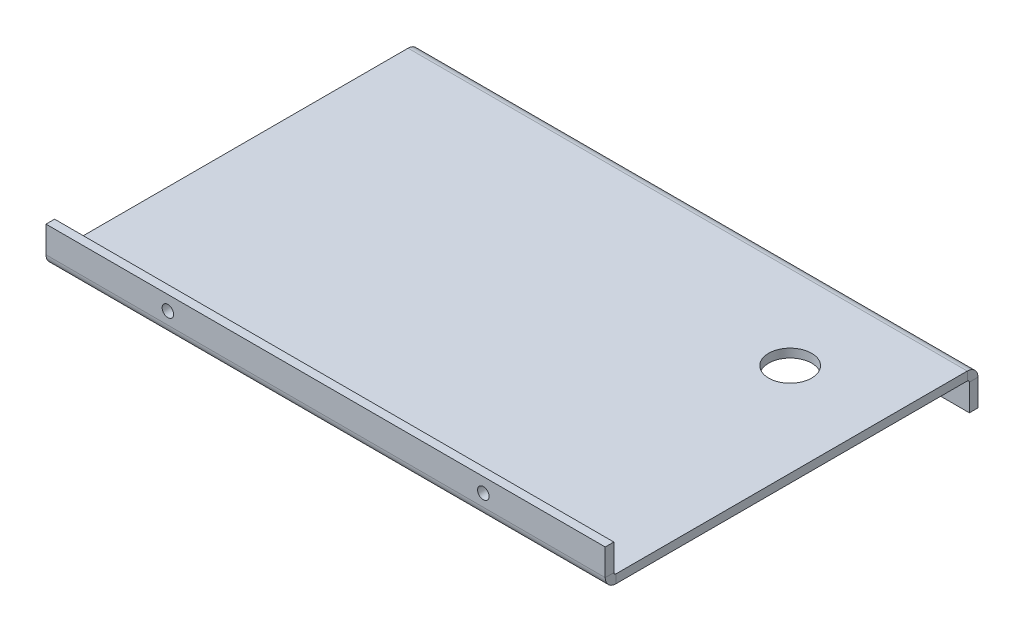
from build123d import *

# Parameters (mm, degrees)
SKETCH_1_W                       = 195
SKETCH_1_H                       = 130
SM_BASE_FLANGE_1_DEPTH           = 3
SM_EDGE_FLANGE_1_STRIP_W         = 13.4732
SM_EDGE_FLANGE_1_STRIP_H         = 3
SM_EDGE_FLANGE_1_STRIP_CUT_DEPTH = 195
SM_EDGE_FLANGE_1_DEPTH           = 195
SM_EDGE_FLANGE_2_STRIP_W         = 13.4732
SM_EDGE_FLANGE_2_STRIP_H         = 3
SM_EDGE_FLANGE_2_STRIP_CUT_DEPTH = 195
SM_EDGE_FLANGE_2_DEPTH           = 195
SKETCH_12_R                      = 2
CUT_EXTRUDE_1_DEPTH              = 10
SKETCH_13_R                      = 2
CUT_EXTRUDE_2_DEPTH              = 10
CUT_EXTRUDE_3_REACH              = 119.899
SKETCH_14_R                      = 7.5


# Sheet-metal steps are written as plain solids
with BuildPart() as part:
    # Sketch 1 → 基体-法兰1 (new body)
    with BuildSketch(Plane(origin=(0, 0, 0), x_dir=(1, 0, 0), z_dir=(0, 1, 0))):
        Rectangle(SKETCH_1_W, SKETCH_1_H)
    extrude(amount=-SM_BASE_FLANGE_1_DEPTH)

    # 边线-法兰1 strip (across the edge) → 边线-法兰1 strip cut (cut)
    with BuildSketch(Plane(origin=(-97.5, 0, 65), x_dir=(0, 0, -1), z_dir=(1, 0, 0))):
        with Locations((-3, -1.5)):
            Rectangle(SM_EDGE_FLANGE_1_STRIP_W, SM_EDGE_FLANGE_1_STRIP_H)
    extrude(amount=SM_EDGE_FLANGE_1_STRIP_CUT_DEPTH, mode=Mode.SUBTRACT)

    # 边线-法兰1 section (across the edge) → 边线-法兰1 (add)
    with BuildSketch(Plane(origin=(-97.5, 0, 65), x_dir=(0, 0, -1), z_dir=(1, 0, 0))):
        with BuildLine():
            Line((0, 0.7366), (0, 10))
            Line((0, 10), (3, 10))
            Line((3, 10), (3, 0.7366))
            ThreePointArc((3, 0.7366), (3.215745145, 0.215745145), (3.7366, 0))
            Line((3.7366, 0), (3.7366, -3))
            ThreePointArc((3.7366, -3), (1.094424801, -1.905575199), (0, 0.7366))
        make_face()
    extrude(amount=SM_EDGE_FLANGE_1_DEPTH)

    # 边线-法兰2 strip (across the edge) → 边线-法兰2 strip cut (cut)
    with BuildSketch(Plane(origin=(-97.5, -3, -65), x_dir=(0, 0, 1), z_dir=(1, 0, 0))):
        with Locations((-3, -1.5)):
            Rectangle(SM_EDGE_FLANGE_2_STRIP_W, SM_EDGE_FLANGE_2_STRIP_H)
    extrude(amount=SM_EDGE_FLANGE_2_STRIP_CUT_DEPTH, mode=Mode.SUBTRACT)

    # 边线-法兰2 section (across the edge) → 边线-法兰2 (add)
    with BuildSketch(Plane(origin=(-97.5, -3, -65), x_dir=(0, 0, 1), z_dir=(1, 0, 0))):
        with BuildLine():
            Line((0, 0.7366), (0, 10))
            Line((0, 10), (3, 10))
            Line((3, 10), (3, 0.7366))
            ThreePointArc((3, 0.7366), (3.215745145, 0.215745145), (3.7366, 0))
            Line((3.7366, 0), (3.7366, -3))
            ThreePointArc((3.7366, -3), (1.094424801, -1.905575199), (0, 0.7366))
        make_face()
    extrude(amount=SM_EDGE_FLANGE_2_DEPTH)

    # 草图12 → 切除-拉伸1 (cut)
    with BuildSketch(Plane.XY.offset(65)):
        with Locations((-55, 5)):
            Circle(SKETCH_12_R)
        with Locations(Location((55, 5, 0), (0, 0, 180))):
            Circle(SKETCH_12_R)
    extrude(amount=-CUT_EXTRUDE_1_DEPTH, mode=Mode.SUBTRACT)

    # 草图13 → 切除-拉伸2 (cut)
    with BuildSketch(Plane(origin=(0, 0, -65), x_dir=(-1, 0, 0), z_dir=(0, 0, -1))):
        with Locations(Location((-55, -8, 0), (0, 0, 90))):
            Circle(SKETCH_13_R)
        with Locations(Location((55, -8, 0), (0, 0, 270))):
            Circle(SKETCH_13_R)
    extrude(amount=-CUT_EXTRUDE_2_DEPTH, mode=Mode.SUBTRACT)

    # 草图14 → 切除-拉伸3 (cut, up to next)
    with BuildSketch(Plane.XZ.offset(3), mode=Mode.PRIVATE) as cut_extrude_3_sk1:
        with Locations(Location((65, -32, 0), (0, 0, 270))):
            Circle(SKETCH_14_R)
    cut_extrude_3_tool1 = extrude(cut_extrude_3_sk1.sketch, amount=-CUT_EXTRUDE_3_REACH, mode=Mode.PRIVATE) & part.part
    add(cut_extrude_3_tool1.solids().sort_by_distance((65, -3, -32))[0], mode=Mode.SUBTRACT)


solid = part.part
